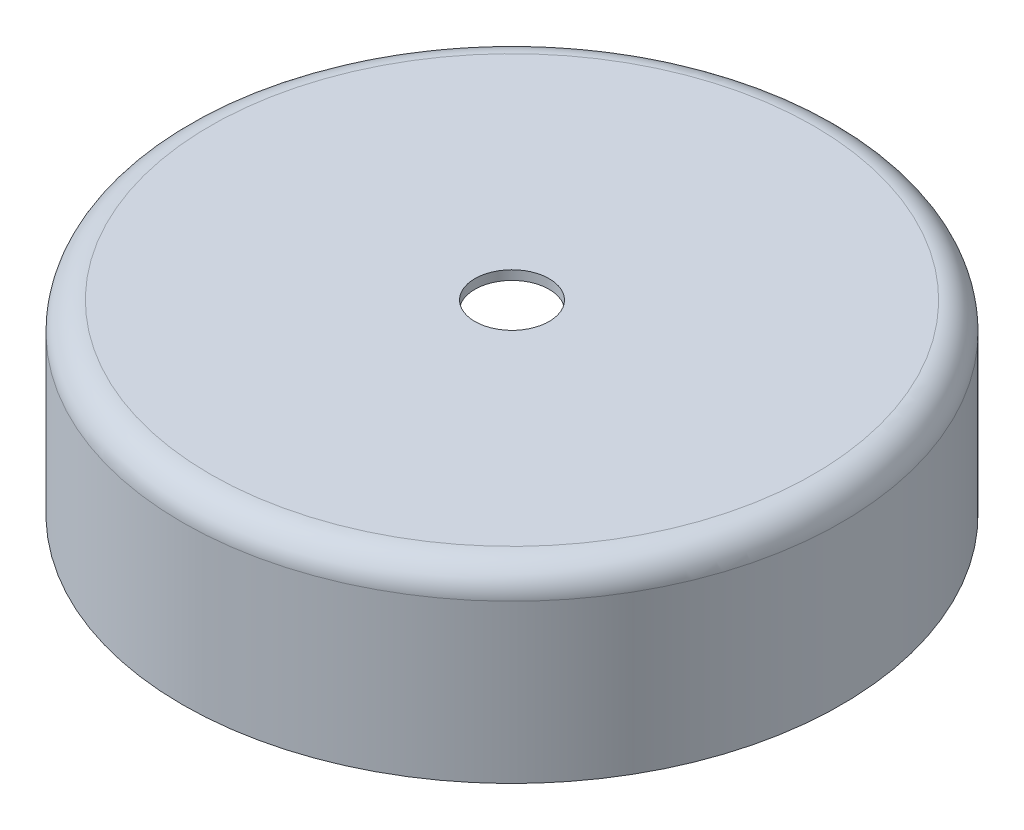
from build123d import *

# Parameters (mm, degrees)
ESQUISSE1_R             = 35.5
BOSS_EXTRU_1_DEPTH      = 20
CONG_1_R                = 3
ESQUISSE2_R             = 4
ENL_V_MAT_EXTRU_1_DEPTH = 2


# Read off the part's stored shape, not the designer's step: Coque1
with BuildPart() as part:
    # Esquisse1 → Boss.-Extru.1 (new body)
    with BuildSketch(Plane(origin=(0, 0, 0), x_dir=(1, 0, 0), z_dir=(0, 1, 0))):
        with Locations(Location((0, 0, 0), (0, 0, 270))):
            Circle(ESQUISSE1_R)
    extrude(amount=BOSS_EXTRU_1_DEPTH)

    # Congé1
    cong_1_edges = [part.edges().sort_by_distance(p)[0] for p in [
        (0, 20, -35.5),
    ]]
    fillet(cong_1_edges, radius=CONG_1_R)

    # Coque1 outline → Coque1 (revolve, cut)
    with BuildSketch(Plane.XY):
        with BuildLine():
            Line((34.5, 0), (34.5, 17))
            ThreePointArc((34.5, 17), (33.914213562, 18.414213562), (32.5, 19))
            Line((32.5, 19), (0, 19))
            Line((0, 19), (0, 0))
            Line((0, 0), (34.5, 0))
        make_face()
    revolve(axis=Axis((0, 0, 0), (0, 1, 0)), mode=Mode.SUBTRACT)

    # Esquisse2 → Enlèv. mat.-Extru.1 (cut)
    with BuildSketch(Plane(origin=(0, 20, 0), x_dir=(1, 0, 0), z_dir=(0, 1, 0))):
        with Locations(Location((0, 0, 0), (0, 0, 270))):
            Circle(ESQUISSE2_R)
    extrude(amount=-ENL_V_MAT_EXTRU_1_DEPTH, mode=Mode.SUBTRACT)


solid = part.part
